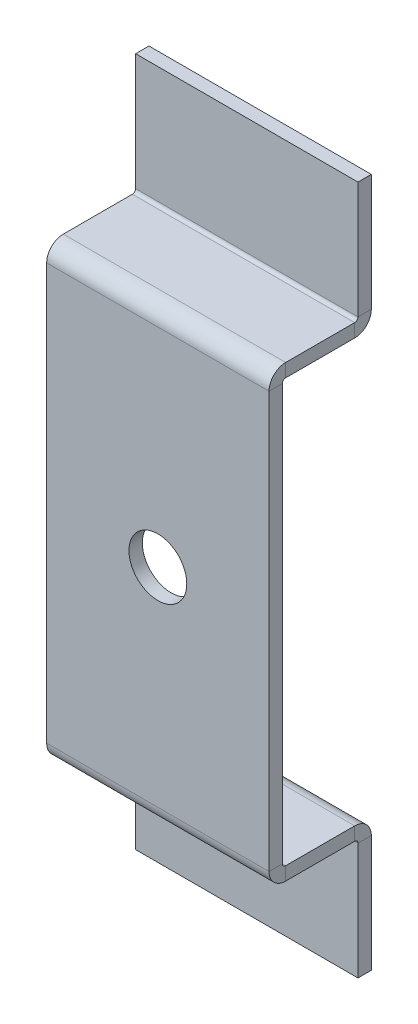
from build123d import *

# Parameters (mm, degrees)
SKETCH_1_W                         = 50
SKETCH_1_H                         = 95
SM_BASE_FLANGE_1_DEPTH             = 3
SM_EDGE_FLANGE_1_STRIP_W           = 13.4732
SM_EDGE_FLANGE_1_STRIP_H           = 3
SM_EDGE_FLANGE_1_STRIP_CUT_DEPTH   = 50
SM_EDGE_FLANGE_1_STRIP_2_W         = 13.4732
SM_EDGE_FLANGE_1_STRIP_2_H         = 3
SM_EDGE_FLANGE_1_STRIP_CUT_2_DEPTH = 50
SM_EDGE_FLANGE_1_DEPTH             = 50
SM_EDGE_FLANGE_1_BEND_DEPTH        = 50
SM_EDGE_FLANGE_2_STRIP_W           = 13.4732
SM_EDGE_FLANGE_2_STRIP_H           = 3
SM_EDGE_FLANGE_2_STRIP_CUT_DEPTH   = 50
SM_EDGE_FLANGE_2_STRIP_2_W         = 13.4732
SM_EDGE_FLANGE_2_STRIP_2_H         = 3
SM_EDGE_FLANGE_2_STRIP_CUT_2_DEPTH = 50
SM_EDGE_FLANGE_2_DEPTH             = 50
SM_EDGE_FLANGE_2_BEND_DEPTH        = 50
SKETCH_18_R                        = 6.5
CUT_EXTRUDE_1_DEPTH                = 137.579647093


# Sheet-metal steps are written as plain solids
with BuildPart() as part:
    # Sketch 1 → 基体-法兰1 (new body)
    with BuildSketch(Plane.XY):
        with Locations((25, 47.5)):
            Rectangle(SKETCH_1_W, SKETCH_1_H)
    extrude(amount=-SM_BASE_FLANGE_1_DEPTH)

    # 边线-法兰1 strip (across the edge) → 边线-法兰1 strip cut (cut)
    with BuildSketch(Plane(origin=(0, 95, -3), x_dir=(0, -1, 0), z_dir=(1, 0, 0))):
        with Locations((-6, -1.5)):
            Rectangle(SM_EDGE_FLANGE_1_STRIP_W, SM_EDGE_FLANGE_1_STRIP_H)
    extrude(amount=SM_EDGE_FLANGE_1_STRIP_CUT_DEPTH, mode=Mode.SUBTRACT)

    # 边线-法兰1 strip 2 (across the edge) → 边线-法兰1 strip cut 2 (cut)
    with BuildSketch(Plane(origin=(50, 0, -3), x_dir=(0, 1, 0), z_dir=(-1, 0, 0))):
        with Locations((-6, -1.5)):
            Rectangle(SM_EDGE_FLANGE_1_STRIP_2_W, SM_EDGE_FLANGE_1_STRIP_2_H)
    extrude(amount=SM_EDGE_FLANGE_1_STRIP_CUT_2_DEPTH, mode=Mode.SUBTRACT)

    # 边线-法兰1 section (across the edge) → 边线-法兰1 (add)
    with BuildSketch(Plane(origin=(0, 95, -3), x_dir=(0, -1, 0), z_dir=(1, 0, 0))):
        with BuildLine():
            Line((-3, 0.7366), (-3, 17))
            Line((-3, 17), (0, 17))
            Line((0, 17), (0, 0.7366))
            ThreePointArc((0, 0.7366), (0.215745145, 0.215745145), (0.7366, 0))
            Line((0.7366, 0), (0.7366, -3))
            ThreePointArc((0.7366, -3), (-1.905575199, -1.905575199), (-3, 0.7366))
        make_face()
    extrude(amount=SM_EDGE_FLANGE_1_DEPTH)

    # 边线-法兰1 section 2 (across the edge) → 边线-法兰1 bend (add)
    with BuildSketch(Plane(origin=(50, 0, -3), x_dir=(0, 1, 0), z_dir=(-1, 0, 0))):
        with BuildLine():
            Line((-3, 0.7366), (-3, 17))
            Line((-3, 17), (0, 17))
            Line((0, 17), (0, 0.7366))
            ThreePointArc((0, 0.7366), (0.215745145, 0.215745145), (0.7366, 0))
            Line((0.7366, 0), (0.7366, -3))
            ThreePointArc((0.7366, -3), (-1.905575199, -1.905575199), (-3, 0.7366))
        make_face()
    extrude(amount=SM_EDGE_FLANGE_1_BEND_DEPTH)

    # 边线-法兰2 strip (across the edge) → 边线-法兰2 strip cut (cut)
    with BuildSketch(Plane(origin=(0, -3, -20), x_dir=(0, 0, 1), z_dir=(1, 0, 0))):
        with Locations((-6, -1.5)):
            Rectangle(SM_EDGE_FLANGE_2_STRIP_W, SM_EDGE_FLANGE_2_STRIP_H)
    extrude(amount=SM_EDGE_FLANGE_2_STRIP_CUT_DEPTH, mode=Mode.SUBTRACT)

    # 边线-法兰2 strip 2 (across the edge) → 边线-法兰2 strip cut 2 (cut)
    with BuildSketch(Plane(origin=(50, 98, -20), x_dir=(0, 0, 1), z_dir=(-1, 0, 0))):
        with Locations((-6, -1.5)):
            Rectangle(SM_EDGE_FLANGE_2_STRIP_2_W, SM_EDGE_FLANGE_2_STRIP_2_H)
    extrude(amount=SM_EDGE_FLANGE_2_STRIP_CUT_2_DEPTH, mode=Mode.SUBTRACT)

    # 边线-法兰2 section (across the edge) → 边线-法兰2 (add)
    with BuildSketch(Plane(origin=(0, -3, -20), x_dir=(0, 0, 1), z_dir=(1, 0, 0))):
        with BuildLine():
            Line((-3, 0.7366), (-3, 27))
            Line((-3, 27), (0, 27))
            Line((0, 27), (0, 0.7366))
            ThreePointArc((0, 0.7366), (0.215745145, 0.215745145), (0.7366, 0))
            Line((0.7366, 0), (0.7366, -3))
            ThreePointArc((0.7366, -3), (-1.905575199, -1.905575199), (-3, 0.7366))
        make_face()
    extrude(amount=SM_EDGE_FLANGE_2_DEPTH)

    # 边线-法兰2 section 2 (across the edge) → 边线-法兰2 bend (add)
    with BuildSketch(Plane(origin=(50, 98, -20), x_dir=(0, 0, 1), z_dir=(-1, 0, 0))):
        with BuildLine():
            Line((-3, 0.7366), (-3, 27))
            Line((-3, 27), (0, 27))
            Line((0, 27), (0, 0.7366))
            ThreePointArc((0, 0.7366), (0.215745145, 0.215745145), (0.7366, 0))
            Line((0.7366, 0), (0.7366, -3))
            ThreePointArc((0.7366, -3), (-1.905575199, -1.905575199), (-3, 0.7366))
        make_face()
    extrude(amount=SM_EDGE_FLANGE_2_BEND_DEPTH)

    # 草图18 → 切除-拉伸1 (cut, through all)
    with BuildSketch(Plane.XY):
        with Locations((25, 47.5)):
            Circle(SKETCH_18_R)
    extrude(amount=-CUT_EXTRUDE_1_DEPTH, mode=Mode.SUBTRACT)


solid = part.part
